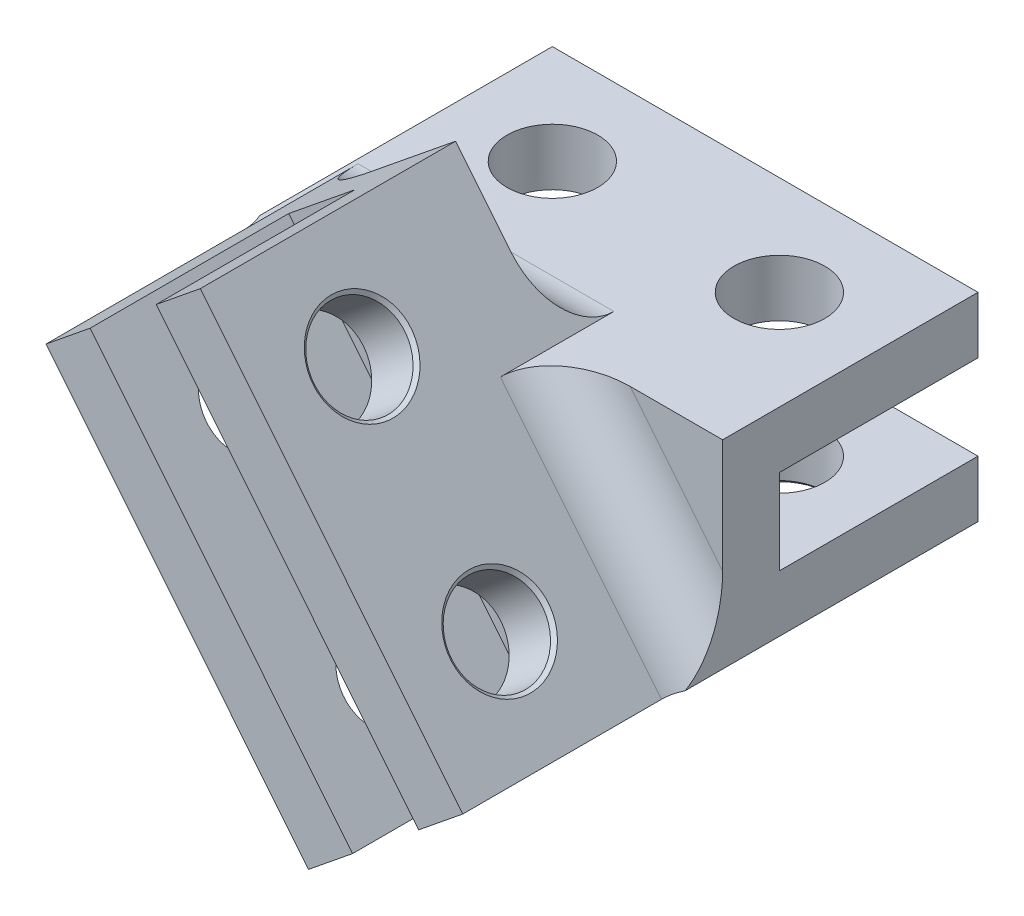
from build123d import *

# Parameters (mm, degrees)
SKETCH1_W                      = 15
SKETCH1_H                      = 2
BOSS_EXTRUDE1_DEPTH            = 7
BOSS_EXTRUDE1_2_DEPTH          = 7
SKETCH2_W                      = 15
SKETCH2_H                      = 7
BOSS_EXTRUDE2_DEPTH            = 2
BOSS_EXTRUDE3_DEPTH            = 9
BOSS_EXTRUDE4_DEPTH            = 2
M3_CLEARANCE_HOLE1_D           = 3.2
M3_CLEARANCE_HOLE1_CSINK_D     = 3.45
M3_CLEARANCE_HOLE1_CSINK_ANGLE = 90
M3_CLEARANCE_HOLE2_D           = 3.2
M3_CLEARANCE_HOLE2_CSINK_D     = 3.45
M3_CLEARANCE_HOLE2_CSINK_ANGLE = 90
FILLET2_R                      = 2
FILLET3_R                      = 2


with BuildPart() as part:
    # Sketch1 → Boss-Extrude1 (new body)
    with BuildSketch(Plane.XY):
        with Locations((51, 4)):
            Rectangle(SKETCH1_W, SKETCH1_H)
    extrude(amount=-BOSS_EXTRUDE1_DEPTH)



with BuildPart() as body_2:
    # Sketch1 → Boss-Extrude1 2 (new body)
    with BuildSketch(Plane.XY):
        with Locations((51, -1)):
            Rectangle(SKETCH1_W, SKETCH1_H)
    extrude(amount=-BOSS_EXTRUDE1_2_DEPTH)


with BuildPart() as part_1:
    add(part.part)

    add(body_2.part)  # Boss-Extrude2 merges body 2
    # Sketch2 → Boss-Extrude2 (add)
    with BuildSketch(Plane.XY):
        with Locations((51, 1.5)):
            Rectangle(SKETCH2_W, SKETCH2_H)
    extrude(amount=BOSS_EXTRUDE2_DEPTH)

    # Sketch3 → Boss-Extrude3 (add)
    with BuildSketch(Plane.XY.offset(2)):
        Polygon((49.332085067, -2), (51.907060552, -2), (46.23047622, 5), (43.655500735, 5), align=None)
        Polygon((52.9075543, -6.409039515), (54.460967148, -5.149313939), (51.907060552, -2), (49.332085067, -2), align=None)
        Polygon((50.092939448, 5), (55.76952378, -2), (58.344499265, -2), (52.667914933, 5), align=None)
        Polygon((47.539032852, 8.149313939), (50.092939448, 5), (52.667914933, 5), (49.0924457, 9.409039515), align=None)
        Polygon((43.655500735, 5), (46.23047622, 5), (45.208913582, 6.259725576), align=None)
        Polygon((58.344499265, -2), (55.76952378, -2), (56.791086418, -3.259725576), align=None)
    extrude(amount=BOSS_EXTRUDE3_DEPTH)

    # Sketch4 → Boss-Extrude4 (add)
    with BuildSketch(Plane.XY.offset(2)):
        Polygon((43.655500735, 5), (52.9075543, -6.409039515), (58.344499265, -2), (49.0924457, 9.409039515), align=None)
    extrude(amount=BOSS_EXTRUDE4_DEPTH)

    # M3 Clearance Hole1 (through all)
    with Locations(Plane(origin=(34.219216483, 27.749752594, 0), x_dir=(0, 0, -1), z_dir=(0.7767064235919557, 0.6298627878760529, 0))):
        with Locations((-7.5, -34.802441812), (-7.5, -27.113443281)):
            CounterSinkHole(M3_CLEARANCE_HOLE1_D / 2, M3_CLEARANCE_HOLE1_CSINK_D / 2, counter_sink_angle=M3_CLEARANCE_HOLE1_CSINK_ANGLE)

    # M3 Clearance Hole2 (through all)
    with Locations(Plane(origin=(0, -2, 0), x_dir=(-1, 0, 0), z_dir=(0, -1, 0))):
        with Locations((-47, 3.5), (-55, 3.5)):
            CounterSinkHole(M3_CLEARANCE_HOLE2_D / 2, M3_CLEARANCE_HOLE2_CSINK_D / 2, counter_sink_angle=M3_CLEARANCE_HOLE2_CSINK_ANGLE)

    # Fillet2
    # the kernel refuses this fillet: 2 mm, written as the material it adds along each edge
    with BuildSketch(Plane(origin=(63.344499265, -2, 2), x_dir=(0, -1, 0), z_dir=(-1, 0, 0))) as fillet2_piece_1_section:
        with BuildLine():
            CenterArc((FILLET2_R, -FILLET2_R), FILLET2_R, 90, 90)
            Line((0, -FILLET2_R), (0, 0))
            Line((0, 0), (FILLET2_R, 0))
        make_face()
    fillet2_piece_1 = extrude(amount=19.012414198, mode=Mode.PRIVATE)
    fillet2_piece_1 = split(fillet2_piece_1, bisect_by=Plane(origin=(51.286566394, -4.410141115, 1.532384034), z_dir=(0.776706423591956, 0.6298627878760524, 0)), keep=Keep.TOP, mode=Mode.PRIVATE)
    fillet2_piece_1 = split(fillet2_piece_1, bisect_by=Plane(origin=(55.372467702, -4.410141115, 1.532384034), z_dir=(-0.6298627878760494, 0.7767064235919585, 0)), keep=Keep.TOP, mode=Mode.PRIVATE)
    add(fillet2_piece_1)
    with BuildSketch(Plane(origin=(38.655500735, 5, 2), x_dir=(0, 0, -1), z_dir=(1, 0, 0))) as fillet2_piece_2_section:
        with BuildLine():
            CenterArc((FILLET2_R, FILLET2_R), FILLET2_R, 180, 90)
            Line((0, FILLET2_R), (0, 0))
            Line((0, 0), (FILLET2_R, 0))
        make_face()
    fillet2_piece_2 = extrude(amount=19.012414198, mode=Mode.PRIVATE)
    fillet2_piece_2 = split(fillet2_piece_2, bisect_by=Plane(origin=(46.627532298, 7.410141115, 1.532384034), z_dir=(0.6298627878760538, -0.776706423591955, 0)), keep=Keep.TOP, mode=Mode.PRIVATE)
    fillet2_piece_2 = split(fillet2_piece_2, bisect_by=Plane(origin=(50.713433606, 7.410141115, 1.532384034), z_dir=(-0.776706423591956, -0.6298627878760528, 0)), keep=Keep.TOP, mode=Mode.PRIVATE)
    add(fillet2_piece_2)

    # Fillet3
    # the kernel refuses this fillet: 2 mm, written as the material it adds along each edge
    with BuildSketch(Plane(origin=(52.481399006, -5.883532118, 2), x_dir=(-0.7767064235919561, -0.6298627878760525, 0), z_dir=(-0.6298627878760524, 0.7767064235919561, 0))) as fillet3_piece_1_section:
        with BuildLine():
            CenterArc((FILLET3_R, FILLET3_R), FILLET3_R, 180, 90)
            Line((0, FILLET3_R), (0, 0))
            Line((0, 0), (FILLET3_R, 0))
        make_face()
    fillet3_piece_1 = extrude(amount=19.012414198, mode=Mode.PRIVATE)
    fillet3_piece_1 = split(fillet3_piece_1, bisect_by=Plane(origin=(46.164389013, 5, 2.465360244), z_dir=(0, -1, 0)), keep=Keep.TOP, mode=Mode.PRIVATE)
    fillet3_piece_1 = split(fillet3_piece_1, bisect_by=Plane(origin=(43.5, 1.248668865, 2.465360244), z_dir=(1, 0, 0)), keep=Keep.TOP, mode=Mode.PRIVATE)
    fillet3_piece_1 = split(fillet3_piece_1, bisect_by=Plane(origin=(46.164389013, -2, 2.465360244), z_dir=(0, 1, 0)), keep=Keep.TOP, mode=Mode.PRIVATE)
    add(fillet3_piece_1)
    with BuildSketch(Plane(origin=(61.493813205, -5.883532118, 2), x_dir=(0, 0, 1), z_dir=(-0.6298627878760524, 0.776706423591956, 0))) as fillet3_piece_2_section:
        with BuildLine():
            CenterArc((FILLET3_R, FILLET3_R), FILLET3_R, 180, 90)
            Line((0, FILLET3_R), (0, 0))
            Line((0, 0), (FILLET3_R, 0))
        make_face()
    fillet3_piece_2 = extrude(amount=19.012414198, mode=Mode.PRIVATE)
    fillet3_piece_2 = split(fillet3_piece_2, bisect_by=Plane(origin=(58.444828917, 5, 2.691548942), z_dir=(0, -1, 0)), keep=Keep.TOP, mode=Mode.PRIVATE)
    fillet3_piece_2 = split(fillet3_piece_2, bisect_by=Plane(origin=(58.5, -1.960151195, 2.691548942), z_dir=(-1, 0, 0)), keep=Keep.TOP, mode=Mode.PRIVATE)
    fillet3_piece_2 = split(fillet3_piece_2, bisect_by=Plane(origin=(58.444828917, -2, 2.691548942), z_dir=(0, 1, 0)), keep=Keep.TOP, mode=Mode.PRIVATE)
    add(fillet3_piece_2)


solid = part_1.part
